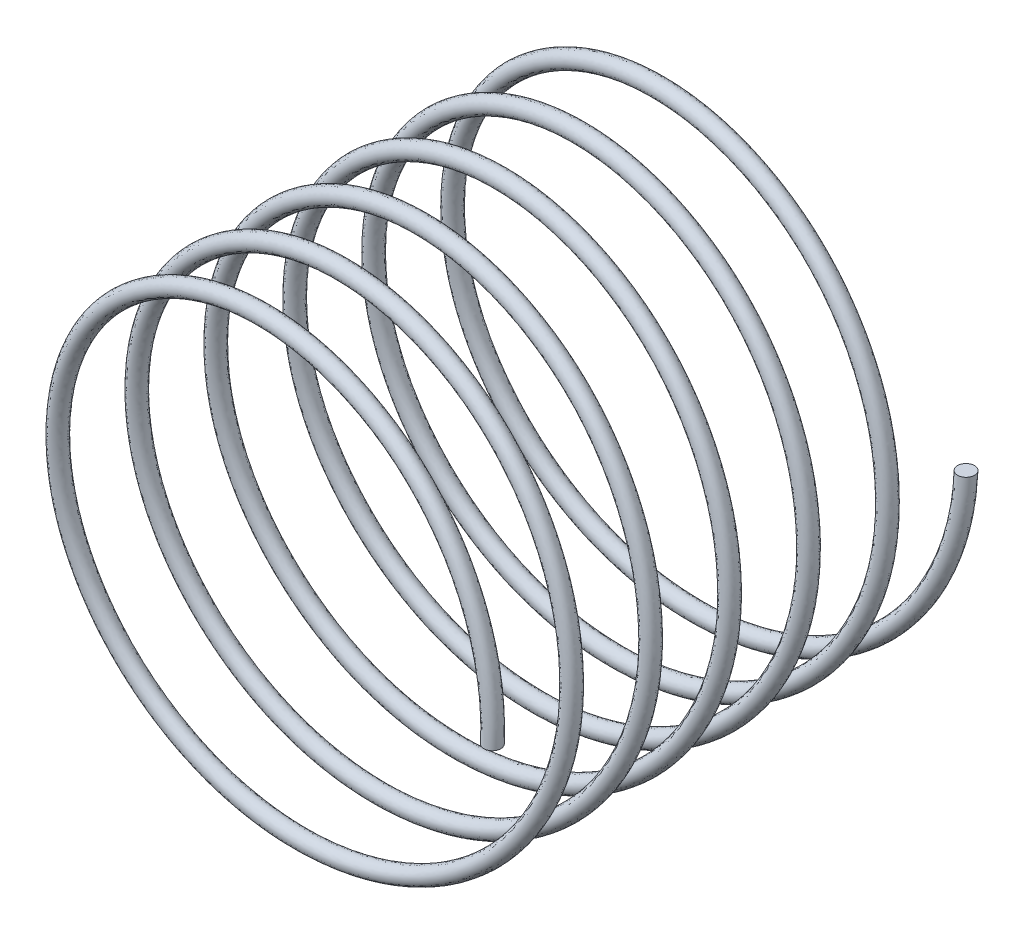
from build123d import *

# Parameters (mm, degrees)
BALAYAGE1_PITCH = 0.933333333


with BuildPart() as part:
    # Balayage1: the profile of Esquisse2 screwed along a left-hand helix of 6 turns, 6 arcs to a turn; built about Z, then put on its axis
    balayage1_z = Axis((0, 0, 0), (0, 0, 1))
    balayage1_corners = [(2.9, 0, 0), (2.8, 0, -0.1), (2.7, 0, 0), (2.8, 0, 0.1)]
    with BuildLine(mode=Mode.PRIVATE) as balayage1_profile:
        ThreePointArc((2.9, 0, 0), (2.870710678, 0, -0.070710678), (2.8, 0, -0.1))
        ThreePointArc((2.8, 0, -0.1), (2.729289322, 0, -0.070710678), (2.7, 0, 0))
        ThreePointArc((2.7, 0, 0), (2.729289322, 0, 0.070710678), (2.8, 0, 0.1))
        ThreePointArc((2.8, 0, 0.1), (2.870710678, 0, 0.070710678), (2.9, 0, 0))
    balayage1_cap = Face(balayage1_profile.wire())
    balayage1_arcs = [((2.9, 0, 0), (2.9, 0, -0.1), (2.8, 0, -0.1), (1, 0.7071067811865477, 1)), ((2.8, 0, -0.1), (2.7, 0, -0.1), (2.7, 0, 0), (1, 0.7071067811865477, 1)), ((2.7, 0, 0), (2.7, 0, 0.1), (2.8, 0, 0.1), (1, 0.7071067811865477, 1)), ((2.8, 0, 0.1), (2.9, 0, 0.1), (2.9, 0, 0), (1, 0.7071067811865477, 1))]  # start, shoulder, end, weights
    balayage1_turn_angles = [0, -30, -60, -90, -120, -150, -180, -210, -240, -270, -300, -330, -360]
    balayage1_turn_weights = [1, 0.8660254037844387, 1, 0.8660254037844387, 1, 0.8660254037844387, 1, 0.8660254037844387, 1, 0.8660254037844387, 1, 0.8660254037844387, 1]
    balayage1_turn_sides = [Face.make_bezier_surface([[Vector(p[j][0], p[j][1], 0).rotate(balayage1_z, balayage1_turn_angles[2 * i + k]) / balayage1_turn_weights[2 * i + k] + Vector(0, 0, p[j][2] + -BALAYAGE1_PITCH * balayage1_turn_angles[2 * i + k] / 360) for k in range(3)] for j in range(3)], [[p[3][j] * balayage1_turn_weights[2 * i + k] for k in range(3)] for j in range(3)]) for p in balayage1_arcs for i in range(6)]
    balayage1 = Plane(origin=(0, 0, 0), x_dir=(1, 0, 0), z_dir=(0, 0, 1)) * Solid(Shell([*[p.moved(Location((0, 0, BALAYAGE1_PITCH * i))) for i in range(6) for p in balayage1_turn_sides], balayage1_cap, balayage1_cap.rotate(balayage1_z, -2160).moved(Location((0, 0, -BALAYAGE1_PITCH * -2160 / 360)))]))
    add(balayage1)


solid = part.part
